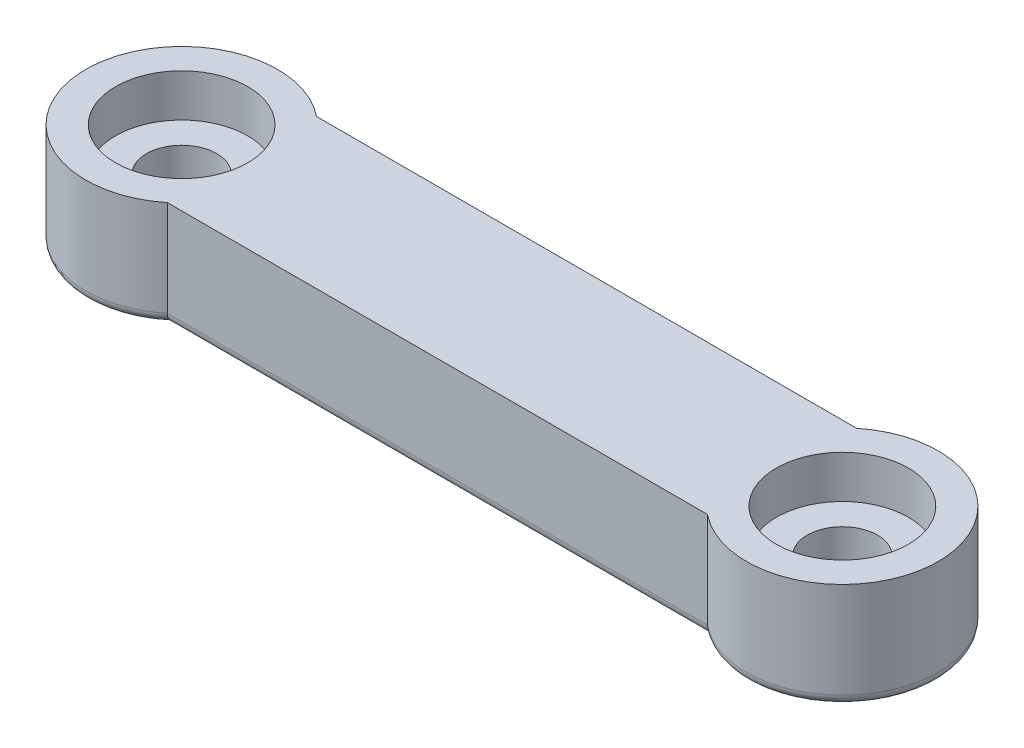
from build123d import *

# Parameters (mm, degrees)
SKETCH1_W           = 31
SKETCH1_H           = 7
BOSS_EXTRUDE1_DEPTH = 5
SKETCH2_R           = 4.5
BOSS_EXTRUDE2_DEPTH = 5
SKETCH3_R           = 1.65
CUT_EXTRUDE1_DEPTH  = 37.732138517
SKETCH4_R           = 3.1
CUT_EXTRUDE2_DEPTH  = 2
FILLET1_R           = 0.5


with BuildPart() as part:
    # Sketch1 → Boss-Extrude1 (new body)
    with BuildSketch(Plane(origin=(0, 0, 0), x_dir=(1, 0, 0), z_dir=(0, 1, 0))):
        with Locations((15.5, 3.5)):
            Rectangle(SKETCH1_W, SKETCH1_H)
    extrude(amount=BOSS_EXTRUDE1_DEPTH)

    # Sketch2 → Boss-Extrude2 (add)
    with BuildSketch(Plane(origin=(0, 5, 0), x_dir=(1, 0, 0), z_dir=(0, 1, 0))):
        with Locations((31, 3.5)):
            Circle(SKETCH2_R)
        with Locations((0, 3.5)):
            Circle(SKETCH2_R)
    extrude(amount=-BOSS_EXTRUDE2_DEPTH)

    # Sketch3 → Cut-Extrude1 (cut, through all)
    with BuildSketch(Plane(origin=(0, 5, 0), x_dir=(1, 0, 0), z_dir=(0, 1, 0))):
        with Locations((0, 3.5)):
            Circle(SKETCH3_R)
        with Locations((31, 3.5)):
            Circle(SKETCH3_R)
    extrude(amount=-CUT_EXTRUDE1_DEPTH, mode=Mode.SUBTRACT)

    # Sketch4 → Cut-Extrude2 (cut)
    with BuildSketch(Plane(origin=(0, 5, 0), x_dir=(1, 0, 0), z_dir=(0, 1, 0))):
        with Locations((0, 3.5)):
            Circle(SKETCH4_R)
        with Locations((31, 3.5)):
            Circle(SKETCH4_R)
    extrude(amount=-CUT_EXTRUDE2_DEPTH, mode=Mode.SUBTRACT)

    # Fillet1
    fillet1_edges = [part.edges().sort_by_distance(p)[0] for p in [
        (35.5, 0, -3.5),
        (15.5, 0, -7),
        (-4.5, 0, -3.5),
        (15.5, 0, 0),
    ]]
    fillet(fillet1_edges, radius=FILLET1_R)


solid = part.part
